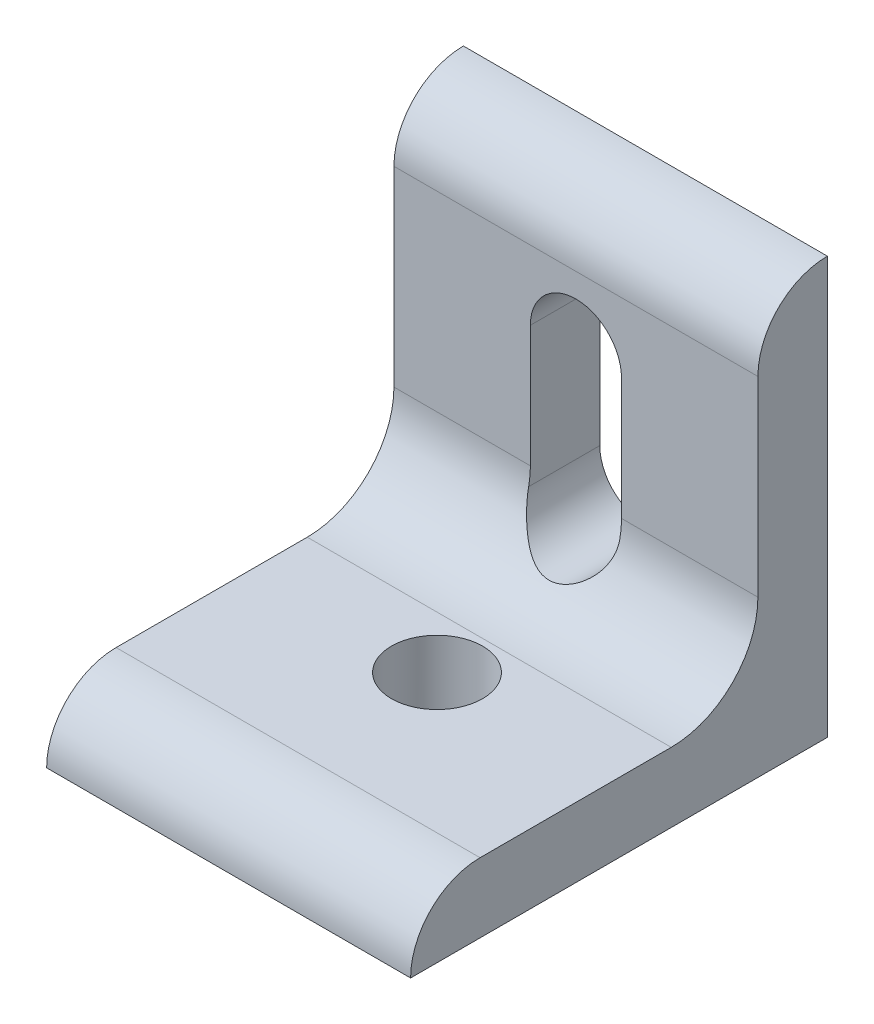
from build123d import *

# Parameters (mm, degrees)
BOSS_EXTRUDE1_DEPTH          = 33.274
CUT_EXTRUDE1_DEPTH           = 53.31120596
F_5_16_CLEARANCE_HOLE1_D     = 8.3312
F_5_16_CLEARANCE_HOLE1_DEPTH = 38.1
FILLET1_START                = -16.637
FILLET1_DEPTH                = 12.4714
FILLET1_START_2              = 4.1656
FILLET1_2_DEPTH              = 12.4714
FILLET1_START_3              = 6.35
FILLET1_3_DEPTH              = 7.9248
FILLET1_START_4              = -4.1656
FILLET1_4_DEPTH              = 8.3312


with BuildPart() as part:
    # Sketch1 → Boss-Extrude1 (new body)
    with BuildSketch(Plane(origin=(-16.637, 0, 0), x_dir=(0, -1, 0), z_dir=(-1, 0, 0))):
        with BuildLine():
            Line((-6.35, 31.75), (-6.35, 6.35))
            Line((-6.35, 6.35), (-31.75, 6.35))
            ThreePointArc((-31.75, 6.35), (-36.240128061, 4.490128061), (-38.1, 0))
            Line((-38.1, 0), (0, 0))
            Line((0, 0), (0, 38.1))
            ThreePointArc((0, 38.1), (-4.490128061, 36.240128061), (-6.35, 31.75))
        make_face()
    extrude(amount=-BOSS_EXTRUDE1_DEPTH)

    # Sketch2 → Cut-Extrude1 (cut, through all)
    with BuildSketch(Plane.XY.offset(6.35)):
        with BuildLine():
            Line((4.1656, 12.7), (4.1656, 25.4))
            ThreePointArc((4.1656, 25.4), (0, 29.5656), (-4.1656, 25.4))
            Line((-4.1656, 25.4), (-4.1656, 12.7))
            ThreePointArc((-4.1656, 12.7), (0, 8.5344), (4.1656, 12.7))
        make_face()
    extrude(amount=-CUT_EXTRUDE1_DEPTH, mode=Mode.SUBTRACT)

    # 5/16 Clearance Hole1
    with Locations(Plane(origin=(0, 0, 0), x_dir=(-1, 0, 0), z_dir=(0, -1, 0))):
        with Locations((0, -19.05)):
            Hole(F_5_16_CLEARANCE_HOLE1_D / 2, depth=F_5_16_CLEARANCE_HOLE1_DEPTH)

    # Fillet1: read off the stored shape, not the designer's step
    # Fillet1 outline → Fillet1 (add)
    with BuildSketch(Plane.YZ.offset(FILLET1_START)):
        with BuildLine():
            ThreePointArc((14.2748, 6.35), (8.67112018, 8.67112018), (6.35, 14.2748))
            Line((6.35, 14.2748), (6.35, 6.35))
            Line((6.35, 6.35), (14.2748, 6.35))
        make_face()
    extrude(amount=FILLET1_DEPTH)

    # Fillet1 2 outline → Fillet1 2 (add)
    with BuildSketch(Plane.YZ.offset(FILLET1_START_2)):
        with BuildLine():
            ThreePointArc((14.2748, 6.35), (8.67112018, 8.67112018), (6.35, 14.2748))
            Line((6.35, 14.2748), (6.35, 6.35))
            Line((6.35, 6.35), (14.2748, 6.35))
        make_face()
    extrude(amount=FILLET1_2_DEPTH)

    # Fillet1 3 outline → Fillet1 3 (add)
    with BuildSketch(Plane.XY.offset(FILLET1_START_3)):
        with BuildLine():
            ThreePointArc((4.1656, 12.7), (0, 8.5344), (-4.1656, 12.7))
            Line((-4.1656, 12.7), (-4.1656, 6.35))
            Line((-4.1656, 6.35), (4.1656, 6.35))
            Line((4.1656, 6.35), (4.1656, 12.7))
        make_face()
    extrude(amount=FILLET1_3_DEPTH)

    # Fillet1 4 outline → Fillet1 4 (cut)
    with BuildSketch(Plane.YZ.offset(FILLET1_START_4)):
        with BuildLine():
            Line((14, 14.2748), (6.35, 14.2748))
            ThreePointArc((6.35, 14.2748), (8.574791663, 8.769133827), (14, 6.354765909))
            Line((14, 6.354765909), (14, 14.2748))
        make_face()
    extrude(amount=FILLET1_4_DEPTH, mode=Mode.SUBTRACT)


solid = part.part
